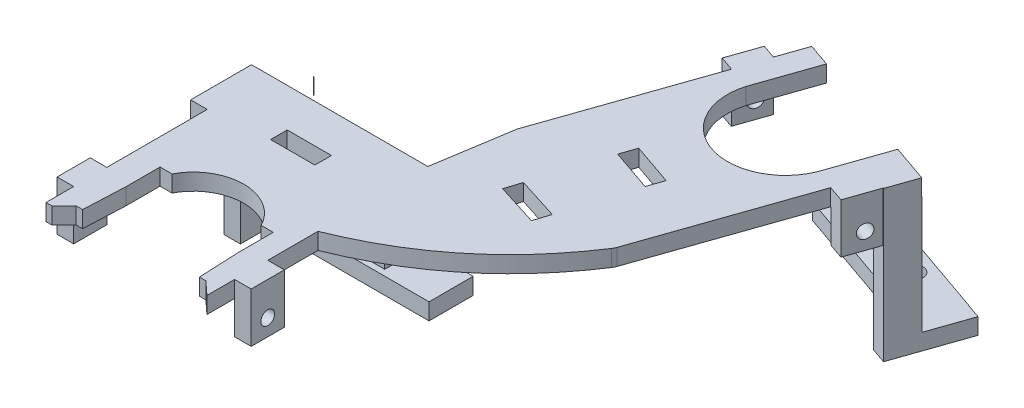
from build123d import *

# Parameters (mm, degrees)
SKETCH1_W                 = 29.13
SKETCH1_H                 = 40.2
BOSS_EXTRUDE1_DEPTH       = 3
SKETCH3_W                 = 6
SKETCH3_H                 = 3
BOSS_EXTRUDE2_DEPTH       = 3
SKETCH4_W                 = 3
SKETCH4_H                 = 6
BOSS_EXTRUDE3_DEPTH       = 6
SKETCH6_W                 = 6
SKETCH6_H                 = 3
BOSS_EXTRUDE4_DEPTH       = 2
SKETCH7_W                 = 3.000000005
SKETCH7_H                 = 6
BOSS_EXTRUDE6_DEPTH       = 6
SKETCH9_R                 = 1.25
CUT_EXTRUDE1_DEPTH        = 3
SKETCH8_R                 = 1.250000001
CUT_EXTRUDE2_DEPTH        = 3
SKETCH11_W                = 6
SKETCH11_H                = 3
BOSS_EXTRUDE7_DEPTH       = 3
SKETCH19_W                = 3
SKETCH19_H                = 6
BOSS_EXTRUDE11_DEPTH      = 6
SKETCH21_W                = 6
SKETCH21_H                = 3
BOSS_EXTRUDE12_DEPTH      = 3
SKETCH22_W                = 3
SKETCH22_H                = 6
BOSS_EXTRUDE13_DEPTH      = 6
SKETCH24_R                = 1.25
CUT_EXTRUDE5_DEPTH        = 4
SKETCH23_R                = 1.25
CUT_EXTRUDE6_DEPTH        = 4
CUT_EXTRUDE8_DEPTH        = 4
CUT_EXTRUDE11_DEPTH       = 4
SKETCH30_W                = 25.92
SKETCH30_H                = 3
CUT_EXTRUDE12_DEPTH       = 15
SKETCH33_W                = 29.17650364
SKETCH33_H                = 3
BOSS_EXTRUDE14_DEPTH      = 40.3
SKETCH34_W                = 21.00258235
SKETCH34_H                = 3
CUT_EXTRUDE15_DEPTH       = 25
CUT_EXTRUDE16_DEPTH       = 5
SKETCH37_W                = 4.5
SKETCH37_H                = 3
SKETCH37_W_2              = 1.5
BOSS_EXTRUDE15_DEPTH      = 3
BOSS_EXTRUDE16_DEPTH      = 6
SKETCH41_W                = 6
SKETCH41_H                = 3
BOSS_EXTRUDE17_DEPTH      = 3
BOSS_EXTRUDE18_DEPTH      = 6
SKETCH46_W                = 5.02
SKETCH46_H                = 3
BOSS_EXTRUDE19_DEPTH      = 3
SKETCH48_W                = 3
SKETCH48_H                = 5.02
BOSS_EXTRUDE20_DEPTH      = 21.1
BOSS_EXTRUDE22_DEPTH      = 29.13
BOSS_EXTRUDE22_DEPTH_BACK = 3
SKETCH50_W                = 8
SKETCH50_H                = 3
SKETCH51_R                = 1.75
CUT_EXTRUDE21_DEPTH       = 5
SKETCH56_W                = 3.994197227
SKETCH56_H                = 3.994197227
CUT_EXTRUDE26_DEPTH       = 0.1
FILLET4_START             = -19
FILLET4_DEPTH             = 5
BOSS_EXTRUDE28_DEPTH      = 0.21
BOSS_EXTRUDE29_DEPTH      = 3
BOSS_EXTRUDE30_DEPTH      = 1.95
BOSS_EXTRUDE30_DEPTH_BACK = 4
SKETCH68_W                = 4.32399603
SKETCH68_H                = 3
SKETCH69_W                = 3.919724064
SKETCH69_H                = 3
BOSS_EXTRUDE31_DEPTH      = 1.83
SKETCH70_W                = 5.44243662
SKETCH70_H                = 3
BOSS_EXTRUDE32_DEPTH      = 3.1
BOSS_EXTRUDE33_DEPTH      = 24.17
SKETCH72_W                = 2.9
SKETCH72_H                = 2.93342148
BOSS_EXTRUDE34_DEPTH      = 8
SKETCH73_W                = 8
SKETCH73_H                = 2.93342148
BOSS_EXTRUDE35_DEPTH      = 29.31
SKETCH74_R                = 1.75
CUT_EXTRUDE27_DEPTH       = 5
SKETCH75_R                = 1.25
CUT_EXTRUDE28_DEPTH       = 5
SKETCH76_R                = 1.25
CUT_EXTRUDE29_DEPTH       = 5
BOSS_EXTRUDE36_DEPTH      = 3
BOSS_EXTRUDE37_DEPTH      = 3
SKETCH79_W                = 8
SKETCH79_H                = 3
CUT_EXTRUDE30_DEPTH       = 10
CUT_EXTRUDE31_DEPTH       = 10


with BuildPart() as part:
    # Sketch1 → Boss-Extrude1 (new body)
    with BuildSketch(Plane(origin=(0, 0, 0), x_dir=(1, 0, 0), z_dir=(0, 1, 0))):
        with Locations((-32.231128585, -983.966354464)):
            Rectangle(SKETCH1_W, SKETCH1_H)
        with BuildLine():
            Line((-15.507778999, -950.239071497), (-17.666128585, -963.866354464))
            Line((-17.666128585, -963.866354464), (-17.666128585, -983.966354464))
            add(Edge.make_bspline(
                [(11.825950039, -959.709415703), (1.028086592, -976.494542347), (-17.666128585, -983.966354464)],
                knots=[0, 0, 0, 1, 1, 1], degree=2))
            Line((11.825950039, -959.709415703), (-15.497121464, -950.208422428))
            Line((-15.497121464, -950.208422428), (-15.507778999, -950.239071497))
        make_face()
    extrude(amount=-BOSS_EXTRUDE1_DEPTH)

    # Sketch3 → Boss-Extrude2 (add)
    with BuildSketch(Plane.ZY.offset(46.796128585)):
        with Locations((971.886354464, -1.5)):
            Rectangle(SKETCH3_W, SKETCH3_H)
    extrude(amount=BOSS_EXTRUDE2_DEPTH)

    # Sketch4 → Boss-Extrude3 (add)
    with BuildSketch(Plane.XZ.offset(3)):
        with Locations((-48.296128585, 971.886354464)):
            Rectangle(SKETCH4_W, SKETCH4_H)
    extrude(amount=BOSS_EXTRUDE3_DEPTH)

    # Sketch6 → Boss-Extrude4 (add)
    with BuildSketch(Plane(origin=(-17.666128585, 0, 0), x_dir=(0, 0, -1), z_dir=(1, 0, 0))):
        with Locations((-971.886354464, -1.5)):
            Rectangle(SKETCH6_W, SKETCH6_H)
    extrude(amount=BOSS_EXTRUDE4_DEPTH)

    # Sketch7 → Boss-Extrude6 (add)
    with BuildSketch(Plane.XZ.offset(3)):
        with Locations((-16.166128583, 971.886354464)):
            Rectangle(SKETCH7_W, SKETCH7_H)
    extrude(amount=BOSS_EXTRUDE6_DEPTH)

    # Sketch9 → Cut-Extrude1 (cut)
    with BuildSketch(Plane.ZY.offset(17.666128585)):
        with Locations((972.066354464, -6)):
            Circle(SKETCH9_R)
    extrude(amount=-CUT_EXTRUDE1_DEPTH, mode=Mode.SUBTRACT)

    # Sketch8 → Cut-Extrude2 (cut)
    with BuildSketch(Plane(origin=(-49.796128585, 0, 0), x_dir=(0, 0, -1), z_dir=(1, 0, 0))):
        with Locations(Location((-972.066168305, -5.999675203, 0), (0, 0, 180))):
            Circle(SKETCH8_R)
    extrude(amount=CUT_EXTRUDE2_DEPTH, mode=Mode.SUBTRACT)

    # Sketch11 → Boss-Extrude7 (add)
    with BuildSketch(Plane.ZY.offset(46.796128585)):
        with Locations((996.056354464, -1.5)):
            Rectangle(SKETCH11_W, SKETCH11_H)
    extrude(amount=BOSS_EXTRUDE7_DEPTH)

    # Sketch19 → Boss-Extrude11 (add)
    with BuildSketch(Plane.XZ.offset(3)):
        with Locations((-48.296128585, 996.056354464)):
            Rectangle(SKETCH19_W, SKETCH19_H)
    extrude(amount=BOSS_EXTRUDE11_DEPTH)

    # Sketch21 → Boss-Extrude12 (add)
    with BuildSketch(Plane(origin=(-17.666128585, 0, 0), x_dir=(0, 0, -1), z_dir=(1, 0, 0))):
        with Locations((-996.056354464, -1.5)):
            Rectangle(SKETCH21_W, SKETCH21_H)
    extrude(amount=BOSS_EXTRUDE12_DEPTH)

    # Sketch22 → Boss-Extrude13 (add)
    with BuildSketch(Plane.XZ.offset(3)):
        with Locations((-16.166128585, 996.056354464)):
            Rectangle(SKETCH22_W, SKETCH22_H)
    extrude(amount=BOSS_EXTRUDE13_DEPTH)

    # Sketch24 → Cut-Extrude5 (cut)
    with BuildSketch(Plane(origin=(-46.796128585, 0, 0), x_dir=(0, 0, -1), z_dir=(1, 0, 0))):
        with Locations((-996.058375158, -6)):
            Circle(SKETCH24_R)
    extrude(amount=-CUT_EXTRUDE5_DEPTH, mode=Mode.SUBTRACT)

    # Sketch23 → Cut-Extrude6 (cut)
    with BuildSketch(Plane.ZY.offset(17.666128585)):
        with Locations((996.058154464, -6)):
            Circle(SKETCH23_R)
    extrude(amount=-CUT_EXTRUDE6_DEPTH, mode=Mode.SUBTRACT)

    # Sketch28 → Cut-Extrude8 (cut)
    with BuildSketch(Plane(origin=(0, 0, 0), x_dir=(1, 0, 0), z_dir=(0, 1, 0))):
        Polygon((-39.266128585, -975.05646378), (-24.308019321, -978.056409122), (-24.326128585, -981.056354464), (-39.266128585, -978.146354464), align=None)
    extrude(amount=-CUT_EXTRUDE8_DEPTH, mode=Mode.SUBTRACT)

    # Sketch29 → Cut-Extrude11 (cut)
    with BuildSketch(Plane(origin=(0, 0, 0), x_dir=(1, 0, 0), z_dir=(0, 1, 0))):
        Polygon((-39.266128585, -975.05646378), (-39.865804676, -988.183184315), (-42.032837695, -988.183184315), (-42.032837695, -994.347976596), (-42.376382193, -1001.868057312), (-43.532474114, -1001.868057312), (-45.730771266, -1004.066354464), (-39.266128585, -1004.066354464), (-39.266128585, -988.183184315), align=None)
        Polygon((-24.308019321, -978.056409122), (-24.326128585, -1004.066354464), (-17.666128585, -1004.066354464), (-20.056128585, -1001.868057312), (-21.216128585, -1001.868057312), (-21.426128585, -997.305136389), (-21.556128585, -994.347976596), (-21.556128585, -988.183184315), (-23.726128585, -988.183184315), align=None)
    extrude(amount=-CUT_EXTRUDE11_DEPTH, mode=Mode.SUBTRACT)


with BuildPart() as cut_extrude11_piece_1:
    # of the separate pieces the step leaves, piece 1, a body of its own (cut_extrude11_pieces)
    add(part.part.solids().sort_by_distance((-17.666128585, 0, 983.966354464))[0])


with BuildPart() as cut_extrude11_piece_2:
    # of the separate pieces the step leaves, piece 2, a body of its own (cut_extrude11_pieces)
    add(part.part.solids().sort_by_distance((-24.326128585, 0, 1004.066354464))[0])


with BuildPart() as cut_extrude12_tool:
    # Sketch30 → Cut-Extrude12 (new body)
    with BuildSketch(Plane.ZY.offset(39.266128585)):
        with Locations((991.106354464, -1.5)):
            Rectangle(SKETCH30_W, SKETCH30_H)
    extrude(amount=-CUT_EXTRUDE12_DEPTH)


with BuildPart() as cut_extrude11_piece_1_1:
    add(cut_extrude11_piece_1.part)

    # Cut-Extrude12: cut by cut_extrude12_tool
    add(cut_extrude12_tool.part, mode=Mode.SUBTRACT)

    # Sketch33 → Boss-Extrude14 (add)
    with BuildSketch(Plane(origin=(-296.443416752, 0, 852.515567448), x_dir=(-0.9445255798324886, 0, -0.32843786176703366), z_dir=(0.3284378617670337, 0, -0.9445255798324887))):
        with Locations((-311.77524668, -1.5)):
            Rectangle(SKETCH33_W, SKETCH33_H)
    extrude(amount=BOSS_EXTRUDE14_DEPTH)

    # Sketch34 → Cut-Extrude15 (cut)
    with BuildSketch(Plane(origin=(-283.207370923, 0, 814.451186581), x_dir=(-0.9445255798324887, 0, -0.32843786176703327), z_dir=(0.32843786176703327, 0, -0.9445255798324887))):
        with Locations((-311.942483261, -1.5)):
            Rectangle(SKETCH34_W, SKETCH34_H)
    extrude(amount=-CUT_EXTRUDE15_DEPTH, mode=Mode.SUBTRACT)

    # Sketch35 → Cut-Extrude16 (cut)
    with BuildSketch(Plane(origin=(0, 0, 0), x_dir=(1, 0, 0), z_dir=(0, 1, 0))):
        Polygon((-6.699400727, -937.069026653), (11.67040627, -948.187810964), (13.138075545, -943.967069892), align=None)
    extrude(amount=-CUT_EXTRUDE16_DEPTH, mode=Mode.SUBTRACT)

    # Sketch37 → Boss-Extrude15 (add)
    with BuildSketch(Plane(origin=(280.946295288, 0, 97.69285498), x_dir=(-0.32843786176743117, 0, 0.9445255798323505), z_dir=(-0.9445255798323505, 0, -0.32843786176743117))):
        with Locations((868.136002588, -1.5)):
            Rectangle(SKETCH37_W, SKETCH37_H)
        with Locations((871.136002588, -1.5)):
            Rectangle(SKETCH37_W_2, SKETCH37_H)
    extrude(amount=BOSS_EXTRUDE15_DEPTH)

    # Sketch39 → Boss-Extrude16 (add)
    with BuildSketch(Plane.XZ.offset(3)):
        Polygon((-6.277028676, 914.559020058), (-3.745700122, 915.439233528), (-5.716327292, 921.106387007), (-8.247655846, 920.226173537), align=None)
    extrude(amount=BOSS_EXTRUDE16_DEPTH)

    # Sketch41 → Boss-Extrude17 (add)
    with BuildSketch(Plane(origin=(308.258672657, 0, 107.190129606), x_dir=(0.3284378617670337, 0, -0.9445255798324887), z_dir=(0.9445255798324887, 0, 0.3284378617670337))):
        with Locations((-868.898439213, -1.5)):
            Rectangle(SKETCH41_W, SKETCH41_H)
    extrude(amount=BOSS_EXTRUDE17_DEPTH)

    # Sketch42 → Boss-Extrude18 (add)
    with BuildSketch(Plane.XZ.offset(3)):
        Polygon((23.893176542, 925.063208116), (21.922549371, 930.730361595), (24.727790343, 931.705822044), (26.698417514, 926.038668565), align=None)
    extrude(amount=BOSS_EXTRUDE18_DEPTH)


with BuildPart() as cut_extrude11_piece_2_1:
    add(cut_extrude11_piece_2.part)

    # Cut-Extrude12: cut by cut_extrude12_tool
    add(cut_extrude12_tool.part, mode=Mode.SUBTRACT)


with BuildPart() as body_3:
    # Mirror1: mirrored copy
    add(cut_extrude11_piece_1_1.part.mirror(Plane(origin=(0, -9, 0), x_dir=(0, 0, 1), z_dir=(0, -1, 0))))

    # Sketch46 → Boss-Extrude19 (add)
    with BuildSketch(Plane.ZY.offset(46.796128585)):
        with Locations((966.376354464, -16.5)):
            Rectangle(SKETCH46_W, SKETCH46_H)
    extrude(amount=BOSS_EXTRUDE19_DEPTH)

    # Sketch48 → Boss-Extrude20 (add)
    with BuildSketch(Plane(origin=(0, -15, 0), x_dir=(1, 0, 0), z_dir=(0, 1, 0))):
        with Locations((-48.296128585, -966.376354464)):
            Rectangle(SKETCH48_W, SKETCH48_H)
    extrude(amount=BOSS_EXTRUDE20_DEPTH)

    # Sketch50 → Boss-Extrude22 (add, two sides: drawn at the far end of the back side and taken through both)
    with BuildSketch(Plane(origin=(-46.796128585, 0, 0), x_dir=(0, 0, -1), z_dir=(1, 0, 0)).offset(-BOSS_EXTRUDE22_DEPTH_BACK)):
        with Locations((-959.866354464, 4.6)):
            Rectangle(SKETCH50_W, SKETCH50_H)
    extrude(amount=BOSS_EXTRUDE22_DEPTH + BOSS_EXTRUDE22_DEPTH_BACK)

    # Sketch51 → Cut-Extrude21 (cut)
    with BuildSketch(Plane(origin=(0, 6.1, 0), x_dir=(1, 0, 0), z_dir=(0, 1, 0))):
        with Locations(Location((-37.42112854, -959.066354487, 0), (0, 0, 270))):
            Circle(SKETCH51_R)
        with Locations(Location((-27.07112854, -959.066354497, 0), (0, 0, 270))):
            Circle(SKETCH51_R)
    extrude(amount=-CUT_EXTRUDE21_DEPTH, mode=Mode.SUBTRACT)

    # Sketch56 → Cut-Extrude26 (cut)
    with BuildSketch(Plane(origin=(-283.207370923, 0, 814.451186581), x_dir=(-0.9445255798324892, 0, -0.32843786176703227), z_dir=(0.32843786176703227, 0, -0.9445255798324892))):
        with Locations((-299.444093473, -16.997098614)):
            Rectangle(SKETCH56_W, SKETCH56_H)
    extrude(amount=-CUT_EXTRUDE26_DEPTH, mode=Mode.SUBTRACT)

    # Fillet4: read off the stored shape, not the designer's step
    # Fillet4 outline → Fillet4 (cut)
    with BuildSketch(Plane(origin=(0, 0, 0), x_dir=(1, 0, 0), z_dir=(0, 1, 0)).offset(FILLET4_START)):
        with BuildLine():
            Line((11.815255904, -959.705697054), (11.918892326, -959.407658179))
            ThreePointArc((11.918892326, -959.407658179), (11.77847749, -959.744040081), (11.598302874, -960.060909482))
            add(Edge.make_bspline(
                [(11.825950039, -959.709415703), (11.712561825, -959.885676085), (11.598302874, -960.060909482)],
                knots=[0, 0, 0, 0.010500986, 0.010500986, 0.010500986], degree=2))
            Line((11.825950039, -959.709415703), (11.815255904, -959.705697054))
        make_face()
    extrude(amount=FILLET4_DEPTH, mode=Mode.SUBTRACT)


with BuildPart() as body_3_2:
    # Mirror2: mirrored copy
    add(body_3.part.mirror(Plane(origin=(-13.535575409, -18, 962.175671275), x_dir=(0, 0, 1), z_dir=(0, -1, 0))))

    # Sketch63 → Boss-Extrude28 (add)
    with BuildSketch(Plane(origin=(131.691734271, 0, 20.857921628), x_dir=(-0.15643446504022615, 0, 0.9876883405951385), z_dir=(-0.9876883405951385, 0, -0.15643446504022615))):
        with BuildLine():
            add(Edge.make_bspline(
                [(954.763151571, -21), (947.864577189, -21), (940.966002807, -21)],
                knots=[0, 0, 0, 1, 1, 1], degree=2))
            Line((940.966002807, -21), (940.966002807, -18))
            add(Edge.make_bspline(
                [(954.763151571, -18), (947.864577189, -18), (940.966002807, -18)],
                knots=[0, 0, 0, 1, 1, 1], degree=2))
            Line((954.763151571, -18), (954.763151571, -21))
        make_face()
    extrude(amount=BOSS_EXTRUDE28_DEPTH)

    # Sketch67 → Boss-Extrude29 (add)
    with BuildSketch(Plane(origin=(0, -18, 0), x_dir=(1, 0, 0), z_dir=(0, 1, 0))):
        Polygon((-15.715193551, -950.206220259), (-15.742698114, -950.123028585), (-15.497121464, -950.208422428), (-15.507778999, -950.239071497), align=None)
    extrude(amount=-BOSS_EXTRUDE29_DEPTH)

    # Sketch68 → Boss-Extrude30 (add, two sides: drawn at the far end of the back side and taken through both)
    with BuildSketch(Plane(origin=(-283.240214709, 0, 814.545639139), x_dir=(-0.9445255798324883, -3.1744861168227707e-15, -0.32843786176703493), z_dir=(0.32843786176703493, -9.129225613729643e-15, -0.9445255798324883)).offset(-BOSS_EXTRUDE30_DEPTH_BACK)):
        with Locations((-299.279194071, -19.5)):
            Rectangle(SKETCH68_W, SKETCH68_H)
    extrude(amount=BOSS_EXTRUDE30_DEPTH + BOSS_EXTRUDE30_DEPTH_BACK)

    # Sketch69 → Boss-Extrude31 (add)
    with BuildSketch(Plane(origin=(-283.207370923, 0, 814.451186581), x_dir=(-0.9445255798324895, 0, -0.32843786176703144), z_dir=(0.32843786176703144, 0, -0.9445255798324895))):
        with Locations((-324.403636468, -19.5)):
            Rectangle(SKETCH69_W, SKETCH69_H)
    extrude(amount=BOSS_EXTRUDE31_DEPTH)

    # Sketch70 → Boss-Extrude32 (add)
    with BuildSketch(Plane(origin=(308.258672657, 0, 107.190129606), x_dir=(0.3284378617670337, 0, -0.9445255798324887), z_dir=(0.9445255798324887, 0, 0.3284378617670337))):
        with Locations((-863.177220903, -19.5)):
            Rectangle(SKETCH70_W, SKETCH70_H)
    extrude(amount=BOSS_EXTRUDE32_DEPTH)

    # Sketch71 → Boss-Extrude33 (add)
    with BuildSketch(Plane.XZ.offset(21)):
        Polygon((28.589002033, 920.906174309), (26.792870072, 926.071512351), (24.05374589, 925.119042552), (25.841248137, 919.978521948), align=None)
    extrude(amount=BOSS_EXTRUDE33_DEPTH)

    # Sketch72 → Boss-Extrude34 (add)
    with BuildSketch(Plane(origin=(-282.606329636, 0, 812.722704769), x_dir=(-0.9445255798324861, 0, -0.3284378617670412), z_dir=(0.3284378617670412, 0, -0.9445255798324861))):
        with Locations((-328.0134985, -43.70328926)):
            Rectangle(SKETCH72_W, SKETCH72_H)
    extrude(amount=BOSS_EXTRUDE34_DEPTH)

    # Sketch73 → Boss-Extrude35 (add)
    with BuildSketch(Plane(origin=(308.447577773, 0, 107.255817179), x_dir=(-0.32843786176702733, 0, 0.9445255798324909), z_dir=(-0.944525579832491, 0, -0.32843786176702733))):
        with Locations((856.429727564, -43.70328926)):
            Rectangle(SKETCH73_W, SKETCH73_H)
    extrude(amount=BOSS_EXTRUDE35_DEPTH)

    # Sketch74 → Cut-Extrude27 (cut)
    with BuildSketch(Plane.XZ.offset(45.17)):
        with Locations(Location((18.400180873, 912.294602496, 0), (0, 0, 270))):
            Circle(SKETCH74_R)
        with Locations(Location((8.624341118, 908.895270636, 0), (0, 0, 270))):
            Circle(SKETCH74_R)
    extrude(amount=-CUT_EXTRUDE27_DEPTH, mode=Mode.SUBTRACT)


with BuildPart() as body_3_3:
    # Mirror3: read off the stored shape, not the designer's step
    # Mirror3: mirrored copy
    add(body_3_2.part.mirror(Plane(origin=(0, -42.1, 0), x_dir=(1, 0, 0), z_dir=(0, 1, 0))))


with BuildPart() as body_3_4:
    # Mirror4: read off the stored shape, not the designer's step
    # Mirror4: mirrored copy
    add(body_3_3.part.mirror(Plane(origin=(0, -42.1, 0), x_dir=(1, 0, 0), z_dir=(0, 1, 0))))

    # Sketch75 → Cut-Extrude28 (cut)
    with BuildSketch(Plane(origin=(278.112718549, 0, 96.707541395), x_dir=(-0.32843786176743106, 0, 0.9445255798323505), z_dir=(-0.9445255798323505, 0, -0.32843786176743106))):
        with Locations((868.450251665, -23.999675203)):
            Circle(SKETCH75_R)
    extrude(amount=-CUT_EXTRUDE28_DEPTH, mode=Mode.SUBTRACT)

    # Sketch76 → Cut-Extrude29 (cut)
    with BuildSketch(Plane(origin=(311.092249396, 0, 108.175443191), x_dir=(0.32843786176703343, 0, -0.9445255798324887), z_dir=(0.9445255798324889, 0, 0.3284378617670335))):
        with Locations(Location((-868.450251635, -23.999675203, 0), (0, 0, 180))):
            Circle(SKETCH76_R)
    extrude(amount=-CUT_EXTRUDE29_DEPTH, mode=Mode.SUBTRACT)

    # Sketch77 → Boss-Extrude36 (add)
    with BuildSketch(Plane(origin=(0, -18, 0), x_dir=(1, 0, 0), z_dir=(0, 1, 0))):
        with BuildLine():
            Line((-39.266128585, -975.05646378), (-39.865804676, -988.183184315))
            ThreePointArc((-39.865804676, -988.183184315), (-31.795966631, -983.287739608), (-23.726128585, -988.183184315))
            Line((-23.726128585, -988.183184315), (-24.266128585, -978.146354464))
            Line((-24.266128585, -978.146354464), (-24.302851007, -978.146354464))
            Line((-24.302851007, -978.146354464), (-24.308019321, -978.056409122))
            Line((-24.308019321, -978.056409122), (-39.266128585, -975.05646378))
        make_face()
    extrude(amount=-BOSS_EXTRUDE36_DEPTH)

    # Sketch78 → Boss-Extrude37 (add)
    with BuildSketch(Plane(origin=(0, -18, 0), x_dir=(1, 0, 0), z_dir=(0, 1, 0))):
        with BuildLine():
            ThreePointArc((18.196018618, -929.421375958), (4.999614304, -935.398306421), (-1.641457655, -922.52333272))
            Line((-1.641457655, -922.52333272), (-6.699400727, -937.069026653))
            Line((-6.699400727, -937.069026653), (11.67040627, -948.187810964))
            Line((11.67040627, -948.187810964), (18.196018618, -929.421375958))
        make_face()
    extrude(amount=-BOSS_EXTRUDE37_DEPTH)

    # Sketch79 → Cut-Extrude30 (cut)
    with BuildSketch(Plane(origin=(0, -18, 0), x_dir=(1, 0, 0), z_dir=(0, 1, 0))):
        with Locations((-32.334835861, -972.368141655)):
            Rectangle(SKETCH79_W, SKETCH79_H)
        Polygon((-2.641576394, -944.743524907), (1.140719159, -946.045154788), (4.923014713, -947.346784669), (5.899237123, -944.510063004), (-1.665353983, -941.906803242), align=None)
    extrude(amount=-CUT_EXTRUDE30_DEPTH, mode=Mode.SUBTRACT)

    # Sketch84 → Cut-Extrude31 (cut)
    with BuildSketch(Plane(origin=(0, -18, 0), x_dir=(1, 0, 0), z_dir=(0, 1, 0))):
        Polygon((-7.631325194, -960.581359171), (-6.730087577, -957.719931073), (0.90038735, -960.123231383), (-0.000850266, -962.984659481), align=None)
    extrude(amount=-CUT_EXTRUDE31_DEPTH, mode=Mode.SUBTRACT)


solid = Compound([cut_extrude11_piece_2_1.part, body_3_4.part])
